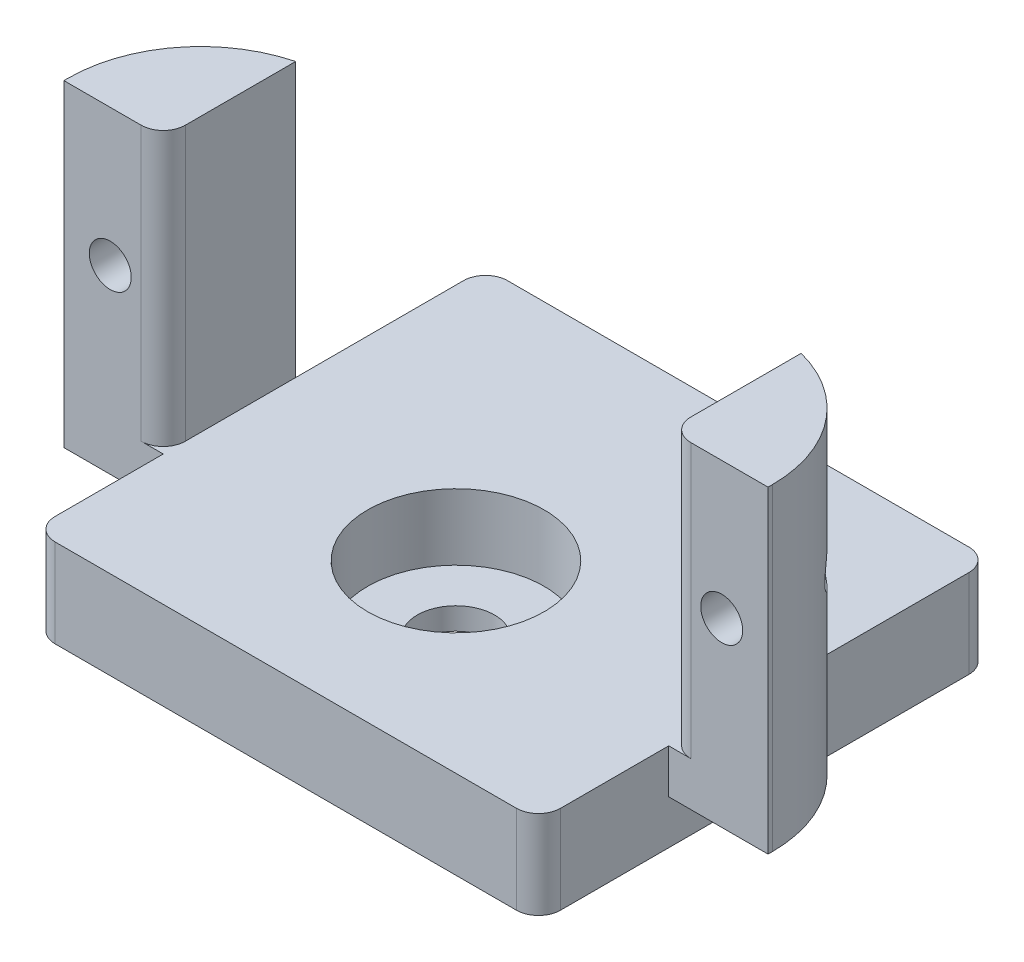
from build123d import *

# Parameters (mm, degrees)
SKETCH_1_W          = 22.9
SKETCH_1_H          = 21
EXTRUDE_1_DEPTH     = 2
SKETCH_2_W          = 4.5
SKETCH_2_H          = 6
EXTRUDE_2_DEPTH     = 14.4
FILLET_1_R          = 1
SKETCH_3_R          = 4
CUT_EXTRUDE_1_DEPTH = 14.4
SKETCH_5_R          = 0.95
CUT_EXTRUDE_2_DEPTH = 14.4
SKETCH_1_2_W        = 22.9
SKETCH_1_2_H        = 21
EXTRUDE_3_DEPTH     = 2
SKETCH_6_R          = 4
CUT_EXTRUDE_3_DEPTH = 1
SKETCH_7_R          = 1.75
CUT_EXTRUDE_4_DEPTH = 1
FILLET_2_R          = 1
SKETCH_9_W          = 22.900603658
SKETCH_9_H          = 0.5
CUT_EXTRUDE_5_DEPTH = 4
FILLET_4_R          = 1
FILLET_5_DEPTH      = 14.4


with BuildPart() as part:
    # 草图1 → 凸台-拉伸1 (new body)
    with BuildSketch(Plane(origin=(0, 0, 0), x_dir=(1, 0, 0), z_dir=(0, 1, 0))):
        Rectangle(SKETCH_1_W, SKETCH_1_H)
    extrude(amount=EXTRUDE_1_DEPTH)

    # 草图2 → 凸台-拉伸2 (add)
    with BuildSketch(Plane(origin=(0, 0, 0), x_dir=(1, 0, 0), z_dir=(0, 1, 0))):
        with Locations((-13.7, -1.1)):
            Rectangle(SKETCH_2_W, SKETCH_2_H)
        with Locations((13.7, -1.1)):
            Rectangle(SKETCH_2_W, SKETCH_2_H)
    extrude(amount=EXTRUDE_2_DEPTH)

    # 圆角1
    fillet_1_edges = [part.edges().sort_by_distance(p)[0] for p in [
        (-11.45, 8.2, 4.1),
        (11.45, 8.2, 4.1),
    ]]
    fillet(fillet_1_edges, radius=FILLET_1_R)

    # 草图3 → 切除-拉伸1 (cut)
    with BuildSketch(Plane(origin=(0, 2, 0), x_dir=(1, 0, 0), z_dir=(0, 1, 0))):
        with Locations(Location((-0.63, -1.66, 0), (0, 0, 270))):
            Circle(SKETCH_3_R)
    extrude(amount=-CUT_EXTRUDE_1_DEPTH, mode=Mode.SUBTRACT)

    # 草图5 → 切除-拉伸2 (cut)
    with BuildSketch(Plane.XY.offset(4.1)):
        with Locations((-13.85, 8.2)):
            Circle(SKETCH_5_R)
        with Locations((13.85, 8.2)):
            Circle(SKETCH_5_R)
    extrude(amount=-CUT_EXTRUDE_2_DEPTH, mode=Mode.SUBTRACT)

    # 草图1<2> → 凸台-拉伸3 (add)
    with BuildSketch(Plane(origin=(0, 0, 0), x_dir=(1, 0, 0), z_dir=(0, 1, 0))):
        Rectangle(SKETCH_1_2_W, SKETCH_1_2_H)
    extrude(amount=-EXTRUDE_3_DEPTH)

    # 草图6 → 切除-拉伸3 (cut)
    with BuildSketch(Plane(origin=(0, 0, 0), x_dir=(1, 0, 0), z_dir=(0, 1, 0))):
        with Locations(Location((-0.63, -1.66, 0), (0, 0, 270))):
            Circle(SKETCH_6_R)
    extrude(amount=-CUT_EXTRUDE_3_DEPTH, mode=Mode.SUBTRACT)

    # 草图7 → 切除-拉伸4 (cut)
    with BuildSketch(Plane(origin=(0, -1, 0), x_dir=(1, 0, 0), z_dir=(0, 1, 0))):
        with Locations(Location((-0.63, -1.66, 0), (0, 0, 270))):
            Circle(SKETCH_7_R)
    extrude(amount=-CUT_EXTRUDE_4_DEPTH, mode=Mode.SUBTRACT)

    # 圆角2
    fillet_2_edges = [part.edges().sort_by_distance(p)[0] for p in [
        (11.45, 0, -10.5),
        (-11.45, 0, -10.5),
    ]]
    fillet(fillet_2_edges, radius=FILLET_2_R)

    # 草图9 → 切除-拉伸5 (cut)
    with BuildSketch(Plane(origin=(0, 2, 0), x_dir=(1, 0, 0), z_dir=(0, 1, 0))):
        with Locations((-0.000301829, -10.25)):
            Rectangle(SKETCH_9_W, SKETCH_9_H)
    extrude(amount=-CUT_EXTRUDE_5_DEPTH, mode=Mode.SUBTRACT)

    # 圆角4
    fillet_4_edges = [part.edges().sort_by_distance(p)[0] for p in [
        (-11.45, 0, 10),
        (11.45, 0, 10),
    ]]
    fillet(fillet_4_edges, radius=FILLET_4_R)

    # 圆角5: read off the stored shape, not the designer's step
    # 圆角5 outline → 圆角5 (cut)
    with BuildSketch(Plane(origin=(0, 0, 0), x_dir=(1, 0, 0), z_dir=(0, 1, 0))):
        with BuildLine():
            ThreePointArc((11.45, 1.9), (14.69341649, -0.235240405), (15.95, -3.909475019))
            Line((15.95, -3.909475019), (15.95, 1.9))
            Line((15.95, 1.9), (11.45, 1.9))
        make_face()
        with BuildLine():
            ThreePointArc((-15.95, -3.909475019), (-14.69341649, -0.235240405), (-11.45, 1.9))
            Line((-11.45, 1.9), (-15.95, 1.9))
            Line((-15.95, 1.9), (-15.95, -3.909475019))
        make_face()
    extrude(amount=FILLET_5_DEPTH, mode=Mode.SUBTRACT)


solid = part.part
